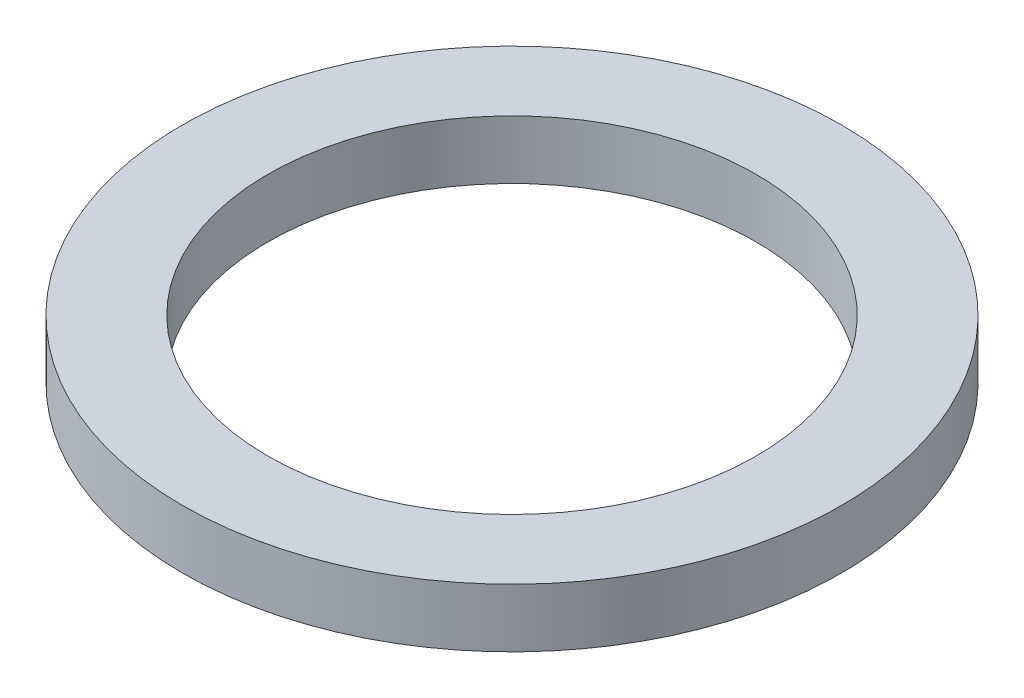
from build123d import *

# Parameters (mm, degrees)
SKETCH1_R           = 67.5
BOSS_EXTRUDE1_DEPTH = 12
SKETCH2_R           = 50
CUT_EXTRUDE1_DEPTH  = 97.210706265


with BuildPart() as part:
    # Sketch1 → Boss-Extrude1 (new body)
    with BuildSketch(Plane(origin=(0, 0, 0), x_dir=(1, 0, 0), z_dir=(0, 1, 0))):
        Circle(SKETCH1_R)
    extrude(amount=BOSS_EXTRUDE1_DEPTH)

    # Sketch2 → Cut-Extrude1 (cut, through all)
    with BuildSketch(Plane(origin=(0, 0, 0), x_dir=(1, 0, 0), z_dir=(0, 1, 0))):
        Circle(SKETCH2_R)
    extrude(amount=CUT_EXTRUDE1_DEPTH, mode=Mode.SUBTRACT)


solid = part.part
